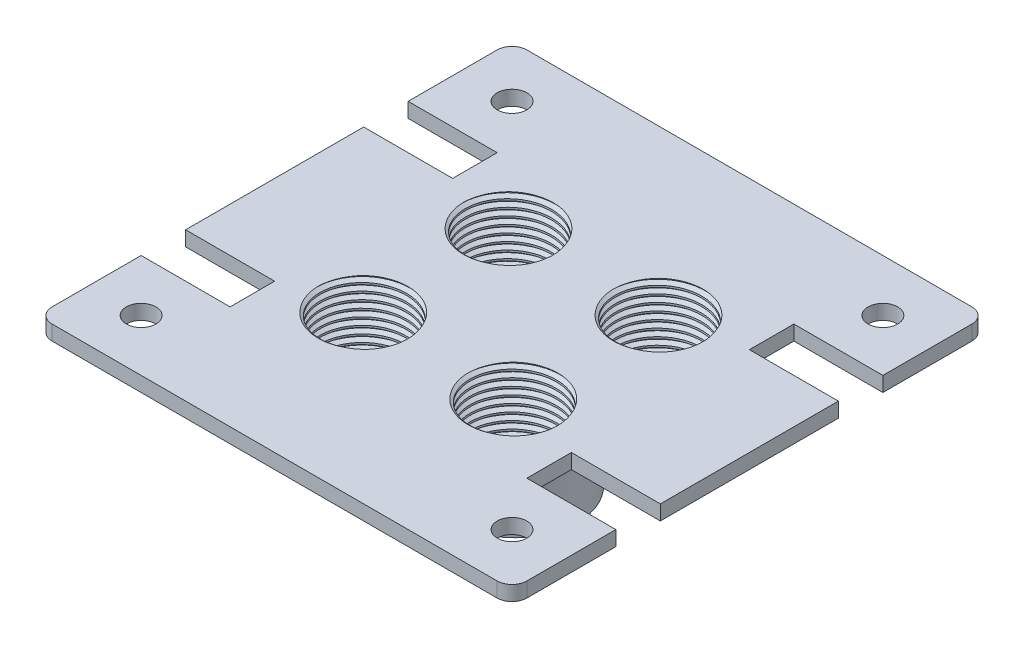
from build123d import *

# Parameters (mm, degrees)
SKETCH1_W           = 64
SKETCH1_H           = 64
SKETCH1_R           = 2
SKETCH1_R_2         = 8.5
BOSS_EXTRUDE1_DEPTH = 2
SKETCH4_W           = 12
SKETCH4_H           = 6
CUT_EXTRUDE1_DEPTH  = 3
BOSS_EXTRUDE2_START = 8
SKETCH5_R           = 8.5
SKETCH5_R_2         = 6.367
SKETCH5_R_3         = 6.367844999
BOSS_EXTRUDE2_DEPTH = 10
THREAD2_PITCH       = 1
THREAD2_FROM        = 3
THREAD2_TO          = 13
THREAD3_PITCH       = 1
THREAD3_FROM        = 3
THREAD3_TO          = 13
THREAD4_PITCH       = 1
THREAD4_FROM        = 3
THREAD4_TO          = 13
THREAD5_PITCH       = 1
THREAD5_FROM        = 3
THREAD5_TO          = 13
FILLET1_R           = 2
FILLET2_R           = 2
FILLET3_R           = 2
FILLET4_R           = 2


with BuildPart() as part:
    # Sketch1 → Boss-Extrude1 (new body)
    with BuildSketch(Plane(origin=(0, 0, 0), x_dir=(1, 0, 0), z_dir=(0, 1, 0))):
        Rectangle(SKETCH1_W, SKETCH1_H)
        with Locations(Location((25, 25, 0), (0, 0, 270))):
            Circle(SKETCH1_R, mode=Mode.SUBTRACT)
        with Locations(Location((25, -25, 0), (0, 0, 270))):
            Circle(SKETCH1_R, mode=Mode.SUBTRACT)
        with Locations(Location((-25, -25, 0), (0, 0, 270))):
            Circle(SKETCH1_R, mode=Mode.SUBTRACT)
        with Locations(Location((-25, 25, 0), (0, 0, 270))):
            Circle(SKETCH1_R, mode=Mode.SUBTRACT)
        with Locations(Location((10.11, 9.79, 0), (0, 0, 270))):
            Circle(SKETCH1_R_2, mode=Mode.SUBTRACT)
        with Locations(Location((-10.11, 9.79, 0), (0, 0, 90))):
            Circle(SKETCH1_R_2, mode=Mode.SUBTRACT)
        with Locations(Location((10.11, -9.79, 0), (0, 0, 90))):
            Circle(SKETCH1_R_2, mode=Mode.SUBTRACT)
        with Locations(Location((-10.11, -9.79, 0), (0, 0, 270))):
            Circle(SKETCH1_R_2, mode=Mode.SUBTRACT)
    extrude(amount=BOSS_EXTRUDE1_DEPTH)

    # Sketch4 → Cut-Extrude1 (cut)
    with BuildSketch(Plane.XZ):
        with Locations((26, 15)):
            Rectangle(SKETCH4_W, SKETCH4_H)
        with Locations((26, -15)):
            Rectangle(SKETCH4_W, SKETCH4_H)
        with Locations((-26, -15)):
            Rectangle(SKETCH4_W, SKETCH4_H)
        with Locations((-26, 15)):
            Rectangle(SKETCH4_W, SKETCH4_H)
    extrude(amount=-CUT_EXTRUDE1_DEPTH, mode=Mode.SUBTRACT)

    # Sketch5 → Boss-Extrude2 (add)
    # profile 1 of 4: a face of its own
    with BuildSketch(Plane.XZ.offset(BOSS_EXTRUDE2_START)):
        with Locations(Location((-10.11, 9.79, 0), (0, 0, 270))):
            Circle(SKETCH5_R)
        with Locations(Location((-10.11, 9.79, 0), (0, 0, 270))):
            Circle(SKETCH5_R_2, mode=Mode.SUBTRACT)
    # profile 2 of 4: a face of its own
    with BuildSketch(Plane.XZ.offset(BOSS_EXTRUDE2_START)):
        with Locations(Location((10.11, 9.79, 0), (0, 0, 270))):
            Circle(SKETCH5_R)
        with Locations(Location((10.11, 9.79, 0), (0, 0, 270))):
            Circle(SKETCH5_R_2, mode=Mode.SUBTRACT)
    # profile 3 of 4: a face of its own
    with BuildSketch(Plane.XZ.offset(BOSS_EXTRUDE2_START)):
        with Locations(Location((-10.11, -9.79, 0), (0, 0, 270))):
            Circle(SKETCH5_R)
        with Locations(Location((-10.11, -9.79, 0), (0, 0, 270))):
            Circle(SKETCH5_R_2, mode=Mode.SUBTRACT)
    # profile 4 of 4: a face of its own
    with BuildSketch(Plane.XZ.offset(BOSS_EXTRUDE2_START)):
        with Locations(Location((10.11, -9.79, 0), (0, 0, 270))):
            Circle(SKETCH5_R)
        with Locations(Location((10.11, -9.79, 0), (0, 0, 270))):
            Circle(SKETCH5_R_3, mode=Mode.SUBTRACT)
    extrude(amount=-BOSS_EXTRUDE2_DEPTH)

    # Thread2: arcs per turn and ends read off the stored shape
    # Thread2: the profile of Thread Profile3 profile screwed along a right-hand helix through 22 turns, 8 arcs to a turn; built about Z, then put on its axis
    thread2_z = Axis((0, 0, 0), (0, 0, 1))
    thread2_corners = [(6.3673, 0, -0.000173205), (6.3673, 0, 0.875173202), (5.825734125, 0, 0.562499999), (5.825734125, 0, 0.312499999)]
    with BuildLine(mode=Mode.PRIVATE) as thread2_profile:
        Line(thread2_corners[0], thread2_corners[1])
        Line(thread2_corners[1], thread2_corners[2])
        Line(thread2_corners[2], thread2_corners[3])
        Line(thread2_corners[3], thread2_corners[0])
    thread2_cap = Face(thread2_profile.wire())
    thread2_turn_angles = [0, 22.5, 45, 67.5, 90, 112.5, 135, 157.5, 180, 202.5, 225, 247.5, 270, 292.5, 315, 337.5, 360]
    thread2_turn_weights = [1, 0.9238795325112867, 1, 0.9238795325112867, 1, 0.9238795325112867, 1, 0.9238795325112867, 1, 0.9238795325112867, 1, 0.9238795325112867, 1, 0.9238795325112867, 1, 0.9238795325112867, 1]
    thread2_turn_rails = [Edge.make_bspline([Vector(p[0], p[1], 0).rotate(thread2_z, thread2_turn_angles[k]) / thread2_turn_weights[k] + Vector(0, 0, p[2] + THREAD2_PITCH * thread2_turn_angles[k] / 360) for k in range(17)], [0, 0, 0, 1, 1, 2, 2, 3, 3, 4, 4, 5, 5, 6, 6, 7, 7, 8, 8, 8], 2, thread2_turn_weights) for p in thread2_corners]
    thread2_turn_sides = [Face.make_surface_from_curves(thread2_turn_rails[p[0]], thread2_turn_rails[p[1]]) for p in [(0, 1), (1, 2), (2, 3), (3, 0)]]
    thread2 = Plane(origin=(-10.11, 5, -9.79), x_dir=(-1, 0, 0), z_dir=(0, -1, 0)) * split(split(Solid(Shell([*[p.moved(Location((0, 0, THREAD2_PITCH * i))) for i in range(22) for p in thread2_turn_sides], thread2_cap, thread2_cap.rotate(thread2_z, 7920).moved(Location((0, 0, THREAD2_PITCH * 7920 / 360)))])), bisect_by=Plane.XY.offset(THREAD2_FROM), keep=Keep.TOP, mode=Mode.PRIVATE), bisect_by=Plane.XY.offset(THREAD2_TO), keep=Keep.BOTTOM, mode=Mode.PRIVATE)
    add(thread2)

    # Thread3: arcs per turn and ends read off the stored shape
    # Thread3: the profile of Thread Profile4 profile screwed along a right-hand helix through 22 turns, 8 arcs to a turn; built about Z, then put on its axis
    thread3_z = Axis((0, 0, 0), (0, 0, 1))
    thread3_corners = [(6.368144999, 0, -0.000173205), (6.368144999, 0, 0.875173202), (5.826579124, 0, 0.562499999), (5.826579124, 0, 0.312499999)]
    with BuildLine(mode=Mode.PRIVATE) as thread3_profile:
        Line(thread3_corners[0], thread3_corners[1])
        Line(thread3_corners[1], thread3_corners[2])
        Line(thread3_corners[2], thread3_corners[3])
        Line(thread3_corners[3], thread3_corners[0])
    thread3_cap = Face(thread3_profile.wire())
    thread3_turn_angles = [0, 22.5, 45, 67.5, 90, 112.5, 135, 157.5, 180, 202.5, 225, 247.5, 270, 292.5, 315, 337.5, 360]
    thread3_turn_weights = [1, 0.9238795325112867, 1, 0.9238795325112867, 1, 0.9238795325112867, 1, 0.9238795325112867, 1, 0.9238795325112867, 1, 0.9238795325112867, 1, 0.9238795325112867, 1, 0.9238795325112867, 1]
    thread3_turn_rails = [Edge.make_bspline([Vector(p[0], p[1], 0).rotate(thread3_z, thread3_turn_angles[k]) / thread3_turn_weights[k] + Vector(0, 0, p[2] + THREAD3_PITCH * thread3_turn_angles[k] / 360) for k in range(17)], [0, 0, 0, 1, 1, 2, 2, 3, 3, 4, 4, 5, 5, 6, 6, 7, 7, 8, 8, 8], 2, thread3_turn_weights) for p in thread3_corners]
    thread3_turn_sides = [Face.make_surface_from_curves(thread3_turn_rails[p[0]], thread3_turn_rails[p[1]]) for p in [(0, 1), (1, 2), (2, 3), (3, 0)]]
    thread3 = Plane(origin=(10.11, 5, -9.79), x_dir=(-1, 0, 0), z_dir=(0, -1, 0)) * split(split(Solid(Shell([*[p.moved(Location((0, 0, THREAD3_PITCH * i))) for i in range(22) for p in thread3_turn_sides], thread3_cap, thread3_cap.rotate(thread3_z, 7920).moved(Location((0, 0, THREAD3_PITCH * 7920 / 360)))])), bisect_by=Plane.XY.offset(THREAD3_FROM), keep=Keep.TOP, mode=Mode.PRIVATE), bisect_by=Plane.XY.offset(THREAD3_TO), keep=Keep.BOTTOM, mode=Mode.PRIVATE)
    add(thread3)

    # Thread4: arcs per turn and ends read off the stored shape
    # Thread4: the profile of Thread Profile5 profile screwed along a right-hand helix through 22 turns, 8 arcs to a turn; built about Z, then put on its axis
    thread4_z = Axis((0, 0, 0), (0, 0, 1))
    thread4_corners = [(6.3673, 0, -0.000173205), (6.3673, 0, 0.875173202), (5.825734125, 0, 0.562499999), (5.825734125, 0, 0.312499999)]
    with BuildLine(mode=Mode.PRIVATE) as thread4_profile:
        Line(thread4_corners[0], thread4_corners[1])
        Line(thread4_corners[1], thread4_corners[2])
        Line(thread4_corners[2], thread4_corners[3])
        Line(thread4_corners[3], thread4_corners[0])
    thread4_cap = Face(thread4_profile.wire())
    thread4_turn_angles = [0, 22.5, 45, 67.5, 90, 112.5, 135, 157.5, 180, 202.5, 225, 247.5, 270, 292.5, 315, 337.5, 360]
    thread4_turn_weights = [1, 0.9238795325112867, 1, 0.9238795325112867, 1, 0.9238795325112867, 1, 0.9238795325112867, 1, 0.9238795325112867, 1, 0.9238795325112867, 1, 0.9238795325112867, 1, 0.9238795325112867, 1]
    thread4_turn_rails = [Edge.make_bspline([Vector(p[0], p[1], 0).rotate(thread4_z, thread4_turn_angles[k]) / thread4_turn_weights[k] + Vector(0, 0, p[2] + THREAD4_PITCH * thread4_turn_angles[k] / 360) for k in range(17)], [0, 0, 0, 1, 1, 2, 2, 3, 3, 4, 4, 5, 5, 6, 6, 7, 7, 8, 8, 8], 2, thread4_turn_weights) for p in thread4_corners]
    thread4_turn_sides = [Face.make_surface_from_curves(thread4_turn_rails[p[0]], thread4_turn_rails[p[1]]) for p in [(0, 1), (1, 2), (2, 3), (3, 0)]]
    thread4 = Plane(origin=(10.11, 5, 9.79), x_dir=(-1, 0, 0), z_dir=(0, -1, 0)) * split(split(Solid(Shell([*[p.moved(Location((0, 0, THREAD4_PITCH * i))) for i in range(22) for p in thread4_turn_sides], thread4_cap, thread4_cap.rotate(thread4_z, 7920).moved(Location((0, 0, THREAD4_PITCH * 7920 / 360)))])), bisect_by=Plane.XY.offset(THREAD4_FROM), keep=Keep.TOP, mode=Mode.PRIVATE), bisect_by=Plane.XY.offset(THREAD4_TO), keep=Keep.BOTTOM, mode=Mode.PRIVATE)
    add(thread4)

    # Thread5: arcs per turn and ends read off the stored shape
    # Thread5: the profile of Thread Profile6 profile screwed along a right-hand helix through 22 turns, 8 arcs to a turn; built about Z, then put on its axis
    thread5_z = Axis((0, 0, 0), (0, 0, 1))
    thread5_corners = [(6.3673, 0, -0.000173205), (6.3673, 0, 0.875173202), (5.825734125, 0, 0.562499999), (5.825734125, 0, 0.312499999)]
    with BuildLine(mode=Mode.PRIVATE) as thread5_profile:
        Line(thread5_corners[0], thread5_corners[1])
        Line(thread5_corners[1], thread5_corners[2])
        Line(thread5_corners[2], thread5_corners[3])
        Line(thread5_corners[3], thread5_corners[0])
    thread5_cap = Face(thread5_profile.wire())
    thread5_turn_angles = [0, 22.5, 45, 67.5, 90, 112.5, 135, 157.5, 180, 202.5, 225, 247.5, 270, 292.5, 315, 337.5, 360]
    thread5_turn_weights = [1, 0.9238795325112867, 1, 0.9238795325112867, 1, 0.9238795325112867, 1, 0.9238795325112867, 1, 0.9238795325112867, 1, 0.9238795325112867, 1, 0.9238795325112867, 1, 0.9238795325112867, 1]
    thread5_turn_rails = [Edge.make_bspline([Vector(p[0], p[1], 0).rotate(thread5_z, thread5_turn_angles[k]) / thread5_turn_weights[k] + Vector(0, 0, p[2] + THREAD5_PITCH * thread5_turn_angles[k] / 360) for k in range(17)], [0, 0, 0, 1, 1, 2, 2, 3, 3, 4, 4, 5, 5, 6, 6, 7, 7, 8, 8, 8], 2, thread5_turn_weights) for p in thread5_corners]
    thread5_turn_sides = [Face.make_surface_from_curves(thread5_turn_rails[p[0]], thread5_turn_rails[p[1]]) for p in [(0, 1), (1, 2), (2, 3), (3, 0)]]
    thread5 = Plane(origin=(-10.11, 5, 9.79), x_dir=(-1, 0, 0), z_dir=(0, -1, 0)) * split(split(Solid(Shell([*[p.moved(Location((0, 0, THREAD5_PITCH * i))) for i in range(22) for p in thread5_turn_sides], thread5_cap, thread5_cap.rotate(thread5_z, 7920).moved(Location((0, 0, THREAD5_PITCH * 7920 / 360)))])), bisect_by=Plane.XY.offset(THREAD5_FROM), keep=Keep.TOP, mode=Mode.PRIVATE), bisect_by=Plane.XY.offset(THREAD5_TO), keep=Keep.BOTTOM, mode=Mode.PRIVATE)
    add(thread5)

    # Fillet1
    fillet1_edges = [part.edges().sort_by_distance(p)[0] for p in [
        (32, 1, -32),
    ]]
    fillet(fillet1_edges, radius=FILLET1_R)

    # Fillet2
    fillet2_edges = [part.edges().sort_by_distance(p)[0] for p in [
        (32, 1, 32),
    ]]
    fillet(fillet2_edges, radius=FILLET2_R)

    # Fillet3
    fillet3_edges = [part.edges().sort_by_distance(p)[0] for p in [
        (-32, 1, 32),
    ]]
    fillet(fillet3_edges, radius=FILLET3_R)

    # Fillet4
    fillet4_edges = [part.edges().sort_by_distance(p)[0] for p in [
        (-32, 1, -32),
    ]]
    fillet(fillet4_edges, radius=FILLET4_R)


solid = part.part
